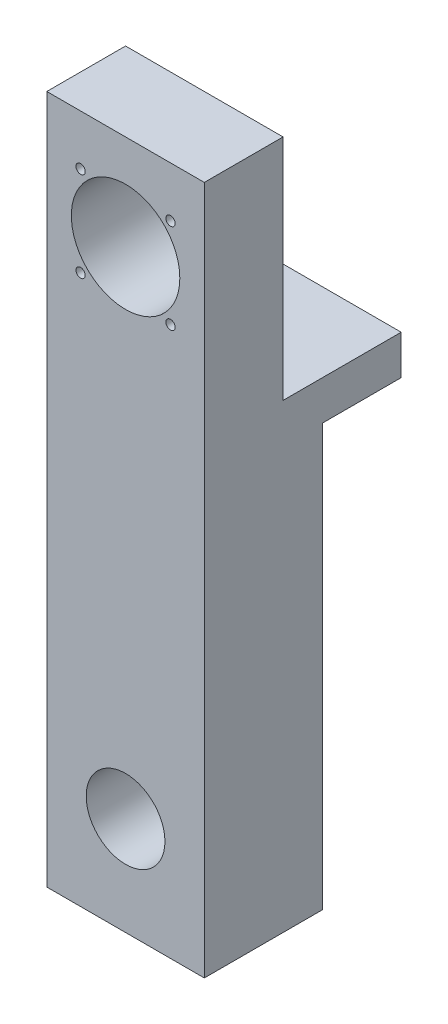
from build123d import *

# Parameters (mm, degrees)
SKETCH2_W           = 50.8
SKETCH2_H           = 38.1
BOSS_EXTRUDE1_DEPTH = 222.25
SKETCH3_R           = 12.7
CUT_EXTRUDE1_DEPTH  = 227.918118492
SKETCH4_R           = 17.500000052
CUT_EXTRUDE2_DEPTH  = 227.918118492
SKETCH8_W           = 50.8
SKETCH8_H           = 12.7
BOSS_EXTRUDE3_DEPTH = 38.1
SKETCH12_R          = 1.500000048
CUT_EXTRUDE5_DEPTH  = 227.918118492
SKETCH13_W          = 50.8
SKETCH13_H          = 73.599329941
CUT_EXTRUDE6_DEPTH  = 12.7
SKETCH14_W          = 50.8
SKETCH14_H          = 12.7
CUT_EXTRUDE7_DEPTH  = 12.7


with BuildPart() as part:
    # Sketch2 → Boss-Extrude1 (new body)
    with BuildSketch(Plane(origin=(0, 0, 0), x_dir=(1, 0, 0), z_dir=(0, 1, 0))):
        Rectangle(SKETCH2_W, SKETCH2_H)
    extrude(amount=BOSS_EXTRUDE1_DEPTH)

    # Sketch3 → Cut-Extrude1 (cut, through all)
    with BuildSketch(Plane.XY.offset(19.05)):
        with Locations((0, 31.75)):
            Circle(SKETCH3_R)
    extrude(amount=-CUT_EXTRUDE1_DEPTH, mode=Mode.SUBTRACT)

    # Sketch4 → Cut-Extrude2 (cut, through all)
    with BuildSketch(Plane.XY.offset(19.05)):
        with Locations((0, 191.550000059)):
            Circle(SKETCH4_R)
    extrude(amount=-CUT_EXTRUDE2_DEPTH, mode=Mode.SUBTRACT)

    # Sketch8 → Boss-Extrude3 (add)
    with BuildSketch(Plane(origin=(0, 0, -19.05), x_dir=(-1, 0, 0), z_dir=(0, 0, -1))):
        with Locations((0, 142.300670059)):
            Rectangle(SKETCH8_W, SKETCH8_H)
    extrude(amount=BOSS_EXTRUDE3_DEPTH)

    # Sketch12 → Cut-Extrude5 (cut, through all)
    with BuildSketch(Plane(origin=(0, 0, -19.05), x_dir=(-1, 0, 0), z_dir=(0, 0, -1))):
        with Locations((14.5034, 206.053400059)):
            Circle(SKETCH12_R)
        with Locations((-14.5034, 206.053400059)):
            Circle(SKETCH12_R)
        with Locations((-14.5034, 177.046600059)):
            Circle(SKETCH12_R)
        with Locations((14.5034, 177.046600059)):
            Circle(SKETCH12_R)
    extrude(amount=-CUT_EXTRUDE5_DEPTH, mode=Mode.SUBTRACT)

    # Sketch13 → Cut-Extrude6 (cut)
    with BuildSketch(Plane(origin=(0, 0, -19.05), x_dir=(-1, 0, 0), z_dir=(0, 0, -1))):
        with Locations((0, 185.45033503)):
            Rectangle(SKETCH13_W, SKETCH13_H)
    extrude(amount=-CUT_EXTRUDE6_DEPTH, mode=Mode.SUBTRACT)

    # Sketch14 → Cut-Extrude7 (cut)
    with BuildSketch(Plane(origin=(0, 0, -57.15), x_dir=(-1, 0, 0), z_dir=(0, 0, -1))):
        with Locations((0, 142.300670059)):
            Rectangle(SKETCH14_W, SKETCH14_H)
    extrude(amount=-CUT_EXTRUDE7_DEPTH, mode=Mode.SUBTRACT)


solid = part.part
